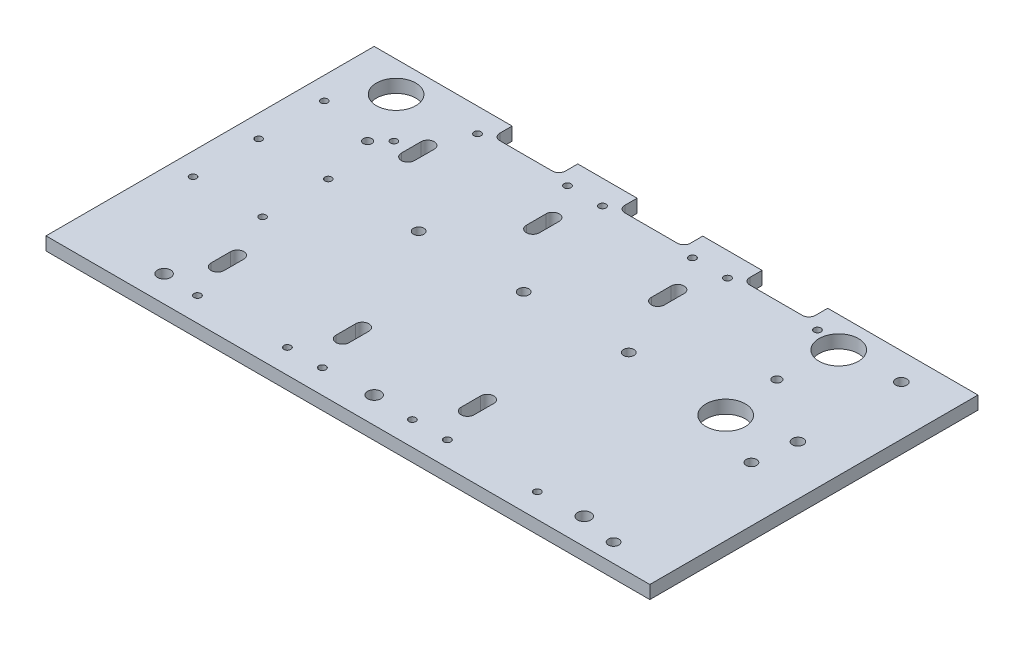
from build123d import *

# Parameters (mm, degrees)
SKETCH1_W           = 292.1
SKETCH1_H           = 158.75
BOSS_EXTRUDE1_DEPTH = 6.35
SKETCH2_R           = 3.175
CUT_EXTRUDE2_DEPTH  = 6.35
SKETCH4_R           = 2.54
SKETCH4_R_2         = 1.651
SKETCH4_R_3         = 2.667
SKETCH4_R_4         = 1.69999914
SKETCH4_R_5         = 2.0955
SKETCH4_R_6         = 9.525
CUT_EXTRUDE5_DEPTH  = 333.512097524


with BuildPart() as part:
    # Sketch1 → Boss-Extrude1 (new body)
    with BuildSketch(Plane(origin=(0, 0, 0), x_dir=(1, 0, 0), z_dir=(0, 1, 0))):
        with Locations((146.05, 79.375)):
            Rectangle(SKETCH1_W, SKETCH1_H)
    extrude(amount=BOSS_EXTRUDE1_DEPTH)

    # Sketch2 → Cut-Extrude2 (cut)
    with BuildSketch(Plane(origin=(0, 6.35, 0), x_dir=(1, 0, 0), z_dir=(0, 1, 0))):
        with Locations((146.05, 12.7)):
            Circle(SKETCH2_R)
        with Locations((247.65, 12.7)):
            Circle(SKETCH2_R)
        with Locations((44.45, 12.7)):
            Circle(SKETCH2_R)
    extrude(amount=-CUT_EXTRUDE2_DEPTH, mode=Mode.SUBTRACT)

    # Sketch4 → Cut-Extrude5 (cut, through all)
    with BuildSketch(Plane(origin=(0, 6.35, 0), x_dir=(1, 0, 0), z_dir=(0, 1, 0))):
        with Locations((88.2015, 92.075)):
            Circle(SKETCH4_R)
        with Locations((44.45, 123.825)):
            Circle(SKETCH4_R_2)
        with Locations((44.45, 92.075)):
            Circle(SKETCH4_R_2)
        with Locations((44.45, 60.325)):
            Circle(SKETCH4_R_2)
        with Locations((10.795, 123.825)):
            Circle(SKETCH4_R_2)
        with Locations((10.795, 92.075)):
            Circle(SKETCH4_R_2)
        with Locations((10.795, 60.325)):
            Circle(SKETCH4_R_2)
        with Locations((139.0015, 92.075)):
            Circle(SKETCH4_R)
        with Locations((189.8015, 92.075)):
            Circle(SKETCH4_R)
        with Locations((268.097, 145.65)):
            Circle(SKETCH4_R_3)
        with Locations((268.097, 95.65)):
            Circle(SKETCH4_R_3)
        with Locations((226.02719192, 147.125001204)):
            Circle(SKETCH4_R_4)
        with Locations((182.52719256, 147.124999631)):
            Circle(SKETCH4_R_4)
        with Locations((165.57179192, 147.125001204)):
            Circle(SKETCH4_R_4)
        with Locations((122.07179256, 147.124999631)):
            Circle(SKETCH4_R_4)
        with Locations((105.11639192, 147.125001204)):
            Circle(SKETCH4_R_4)
        with Locations((61.61639256, 147.124999631)):
            Circle(SKETCH4_R_4)
        with Locations((182.52719746, 11.624998851)):
            Circle(SKETCH4_R_4)
        with Locations((226.02719682, 11.625000424)):
            Circle(SKETCH4_R_4)
        with Locations((165.57179682, 11.625000424)):
            Circle(SKETCH4_R_4)
        with Locations((122.07179746, 11.624998851)):
            Circle(SKETCH4_R_4)
        with Locations((105.11639682, 11.625000424)):
            Circle(SKETCH4_R_4)
        with Locations((61.61639746, 11.624998851)):
            Circle(SKETCH4_R_4)
        with Locations((236.97269445, 116.6114)):
            Circle(SKETCH4_R_5)
        with Locations((239.522, 89.2608)):
            Circle(SKETCH4_R_6)
        with Locations((239.522, 143.962)):
            Circle(SKETCH4_R_6)
        with Locations((25.4, 143.962)):
            Circle(SKETCH4_R_6)
        with Locations((265.5636, 75.6854)):
            Circle(SKETCH4_R)
        with Locations((265.5636, 9.0104)):
            Circle(SKETCH4_R)
        with Locations((38.1, 117.475)):
            Circle(SKETCH4_R_5)
        with BuildLine():
            Line((118.07181063, 130.175), (118.07181063, 120.65))
            ThreePointArc((118.07181063, 120.65), (114.89681063, 117.475), (111.72181063, 120.65))
            Line((111.72181063, 120.65), (111.72181063, 130.175))
            ThreePointArc((111.72181063, 130.175), (114.89681063, 133.35), (118.07181063, 130.175))
        make_face()
        with BuildLine():
            Line((57.61641063, 130.175), (57.61641063, 120.65))
            ThreePointArc((57.61641063, 120.65), (54.44141063, 117.475), (51.26641063, 120.65))
            Line((51.26641063, 120.65), (51.26641063, 130.175))
            ThreePointArc((51.26641063, 130.175), (54.44141063, 133.35), (57.61641063, 130.175))
        make_face()
        with BuildLine():
            Line((178.52721063, 130.175), (178.52721063, 120.65))
            ThreePointArc((178.52721063, 120.65), (175.35221063, 117.475), (172.17721063, 120.65))
            Line((172.17721063, 120.65), (172.17721063, 130.175))
            ThreePointArc((172.17721063, 130.175), (175.35221063, 133.35), (178.52721063, 130.175))
        make_face()
        with BuildLine():
            Line((178.52721063, 38.1), (178.52721063, 28.575))
            ThreePointArc((178.52721063, 28.575), (175.35221063, 25.4), (172.17721063, 28.575))
            Line((172.17721063, 28.575), (172.17721063, 38.1))
            ThreePointArc((172.17721063, 38.1), (175.35221063, 41.275), (178.52721063, 38.1))
        make_face()
        with BuildLine():
            Line((57.61641063, 38.1), (57.61641063, 28.575))
            ThreePointArc((57.61641063, 28.575), (54.44141063, 25.4), (51.26641063, 28.575))
            Line((51.26641063, 28.575), (51.26641063, 38.1))
            ThreePointArc((51.26641063, 38.1), (54.44141063, 41.275), (57.61641063, 38.1))
        make_face()
        with BuildLine():
            Line((118.07181063, 38.1), (118.07181063, 28.575))
            ThreePointArc((118.07181063, 28.575), (114.89681063, 25.4), (111.72181063, 28.575))
            Line((111.72181063, 28.575), (111.72181063, 38.1))
            ThreePointArc((111.72181063, 38.1), (114.89681063, 41.275), (118.07181063, 38.1))
        make_face()
        with BuildLine():
            Line((95.3164, 149.624999566), (69.9164, 149.624999566))
            ThreePointArc((69.9164, 149.624999566), (67.67133597, 150.554935536), (66.7414, 152.799999566))
            Line((66.7414, 152.799999566), (66.7414, 158.75))
            Line((66.7414, 158.75), (98.4914, 158.75))
            Line((98.4914, 158.75), (98.4914, 152.799999566))
            ThreePointArc((98.4914, 152.799999566), (97.56146403, 150.554935536), (95.3164, 149.624999566))
        make_face()
        with BuildLine():
            Line((127.1968, 152.799999566), (127.1968, 158.75))
            Line((127.1968, 158.75), (158.9468, 158.75))
            Line((158.9468, 158.75), (158.9468, 152.799999566))
            ThreePointArc((158.9468, 152.799999566), (158.01686403, 150.554935536), (155.7718, 149.624999566))
            Line((155.7718, 149.624999566), (130.3718, 149.624999566))
            ThreePointArc((130.3718, 149.624999566), (128.12673597, 150.554935536), (127.1968, 152.799999566))
        make_face()
        with BuildLine():
            Line((219.4022, 158.75), (187.6522, 158.75))
            Line((187.6522, 158.75), (187.6522, 152.799999566))
            ThreePointArc((187.6522, 152.799999566), (188.58213597, 150.554935536), (190.8272, 149.624999566))
            Line((190.8272, 149.624999566), (216.2272, 149.624999566))
            ThreePointArc((216.2272, 149.624999566), (218.47226403, 150.554935536), (219.4022, 152.799999566))
            Line((219.4022, 152.799999566), (219.4022, 158.75))
        make_face()
    extrude(amount=-CUT_EXTRUDE5_DEPTH, mode=Mode.SUBTRACT)


solid = part.part
